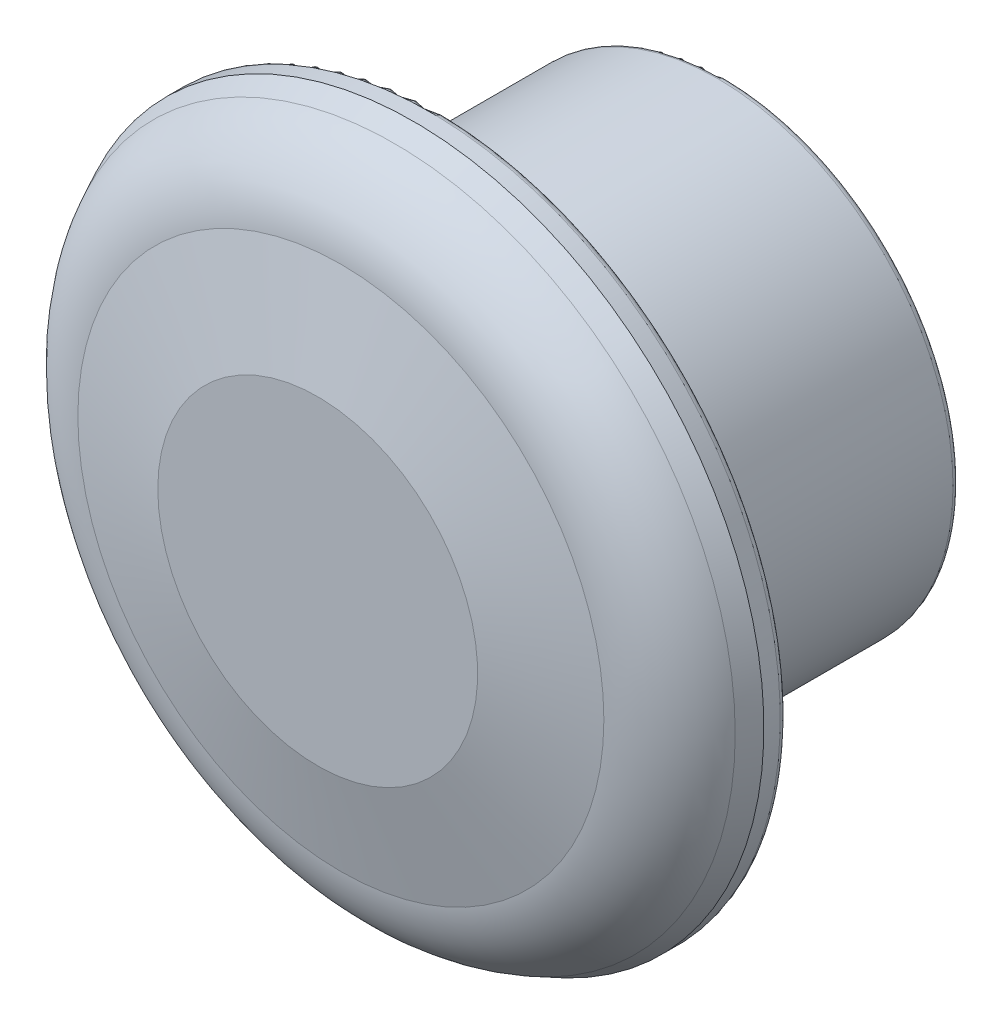
from build123d import *

# Parameters (mm, degrees)
FILLET2_R = 0.2


with BuildPart() as part:
    # Sketch1 → Revolve1 (revolve)
    with BuildSketch(Plane(origin=(0, 0, 0), x_dir=(0, 0, -1), z_dir=(1, 0, 0))):
        with BuildLine():
            Line((2.397152395, 10.655987944), (3, 10.95))
            Line((3, 10.95), (3.712206696, 10.95))
            Line((3.712206696, 10.95), (3.712206696, 8.9))
            Line((3.712206696, 8.9), (4.712206696, 8.9))
            Line((4.712206696, 8.9), (4.712206696, 7.35))
            Line((4.712206696, 7.35), (12.712206696, 7.35))
            Line((12.712206696, 7.35), (12.712206696, 6.35))
            Line((12.712206696, 6.35), (3.256669121, 6.35))
            Line((3.256669121, 6.35), (2.882509958, 6.35))
            ThreePointArc((2.882509958, 6.35), (2.175403177, 6.057106781), (1.882509958, 5.35))
            Line((1.882509958, 5.35), (1.882509958, 0))
            Line((1.882509958, 0), (0, 0))
            Line((0, 0), (0, 5))
            Line((0, 5), (0.723761069, 8.222622081))
            ThreePointArc((0.723761069, 8.222622081), (1.240295439, 9.659475411), (2.397152395, 10.655987944))
        make_face()
    revolve(axis=Axis((0, 0, -1.882509958), (0, 0, 1)))

    # Fillet2
    fillet2_edges = [part.edges().sort_by_distance(p)[0] for p in [
        (0, -6.35, -12.712206696),
        (0, -10.95, -3.712206696),
        (0, -8.9, -4.712206696),
        (0, -7.35, -12.712206696),
    ]]
    fillet(fillet2_edges, radius=FILLET2_R)


solid = part.part
